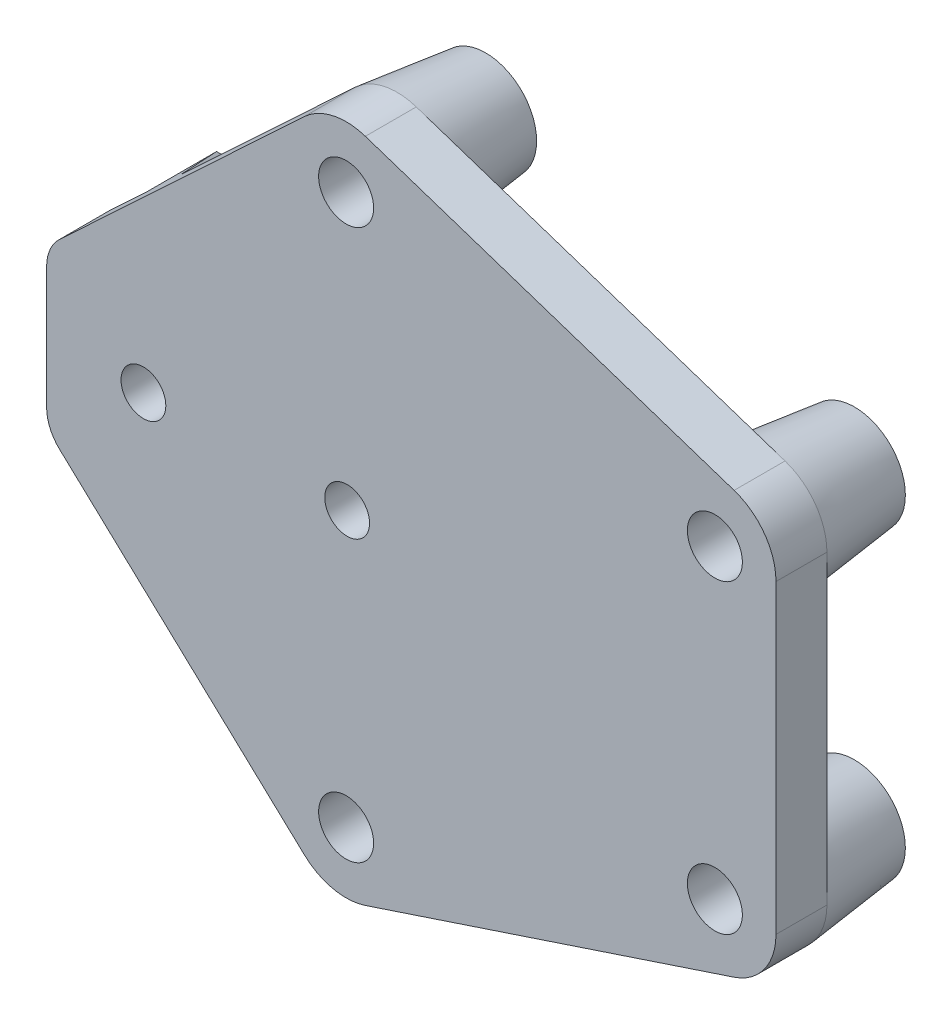
from build123d import *

# Parameters (mm, degrees)
SKETCH_1_R       = 2.7
SKETCH_1_R_2     = 2.2
EXTRUDE_1_DEPTH  = 5
SKETCH_1_4_W     = 29.617054823
SKETCH_1_4_H     = 2
EXTRUDE_2_DEPTH  = 6.8
CHAMFER_1_SIZE   = 3
CHAMFER_1_SIZE_2 = 6.8
CHAMFER_2_SIZE   = 3
CHAMFER_2_SIZE_2 = 6.8


with BuildPart() as part:
    # 草图1 → 凸台-拉伸1 (new body)
    with BuildSketch(Plane.XY):
        with BuildLine():
            Line((-22.196745644, 31.383682827), (-46.231163763, 8.922455218))
            ThreePointArc((-46.231163763, 8.922455218), (-47.169104458, 7.593007368), (-47.5, 6))
            Line((-47.5, 6), (-47.5, -6))
            ThreePointArc((-47.5, -6), (-47.169104458, -7.593007368), (-46.231163763, -8.922455218))
            Line((-46.231163763, -8.922455218), (-22.196745644, -31.383682827))
            ThreePointArc((-22.196745644, -31.383682827), (-19.384432728, -32.860907145), (-16.212075635, -32.695238502))
            Line((-16.212075635, -32.695238502), (19.987924365, -20.695238502))
            ThreePointArc((19.987924365, -20.695238502), (22.964542434, -18.512296529), (24.1, -15))
            Line((24.1, -15), (24.1, 15))
            ThreePointArc((24.1, 15), (22.964542434, 18.512296529), (19.987924365, 20.695238502))
            Line((19.987924365, 20.695238502), (-16.212075635, 32.695238502))
            ThreePointArc((-16.212075635, 32.695238502), (-19.384432728, 32.860907145), (-22.196745644, 31.383682827))
        make_face()
        with Locations((18.1, -15)):
            Circle(SKETCH_1_R, mode=Mode.SUBTRACT)
        with Locations((-38, 0)):
            Circle(SKETCH_1_R_2, mode=Mode.SUBTRACT)
        with Locations((-18, 0)):
            Circle(SKETCH_1_R_2, mode=Mode.SUBTRACT)
        with Locations((-18.1, 27)):
            Circle(SKETCH_1_R, mode=Mode.SUBTRACT)
        with Locations((18.1, 15)):
            Circle(SKETCH_1_R, mode=Mode.SUBTRACT)
        with Locations((-18.1, -27)):
            Circle(SKETCH_1_R, mode=Mode.SUBTRACT)
    extrude(amount=EXTRUDE_1_DEPTH)

    # 草图4 → 旋转1 (revolve)
    with BuildSketch(Plane(origin=(6.272104728, 18.920849262, 0), x_dir=(-0.9492064169502825, 0.3146540608674969, 0), z_dir=(-0.3146540608674969, -0.9492064169502825, 0)), mode=Mode.PRIVATE) as revolve_1_sk:
        Polygon((-6.460825234, 0), (-7.460825234, 8.7), (-9.760825234, 8.7), (-9.760825234, 0), align=None)
    revolve_1 = revolve(revolve_1_sk.sketch.rotate(Axis((18.1, 15, 4.45283877), (0, 0, -1)), 161.660068966), axis=Axis((18.1, 15, 4.45283877), (0, 0, -1)))

    # 草图4<3> → 旋转2 (revolve)
    with BuildSketch(Plane(origin=(6.272104728, 18.920849262, 0), x_dir=(-0.9492064169502825, 0.3146540608674969, 0), z_dir=(-0.3146540608674969, -0.9492064169502825, 0)), mode=Mode.PRIVATE) as revolve_2_sk:
        Polygon((30.67629579, 8.7), (28.37629579, 8.7), (28.37629579, 0), (31.67629579, 0), align=None)
    revolve_2 = revolve(revolve_2_sk.sketch.rotate(Axis((-18.1, 27, 0), (0, 0, -1)), 161.660068966), axis=Axis((-18.1, 27, 0), (0, 0, -1)))

    # 镜向1: 旋转1, 旋转2 across plane
    add(revolve_1.mirror(Plane.ZX))
    add(revolve_2.mirror(Plane.ZX))

    # 草图1<4> → 凸台-拉伸2 (add)
    with BuildSketch(Plane.XY):
        with Locations((-27.808527412, 11.3)):
            Rectangle(SKETCH_1_4_W, SKETCH_1_4_H)
        with Locations((-27.808527412, -11.3)):
            Rectangle(SKETCH_1_4_W, SKETCH_1_4_H)
    extrude(amount=-EXTRUDE_2_DEPTH)

    # 倒角1
    # the kernel refuses this chamfer: 6.8, 3 mm, written as the material it adds along each edge
    with BuildSketch(Plane(origin=(-13, 12.3, 0), x_dir=(0, 0.9968133817371192, 0.07976892872421078), z_dir=(-1, 0, 0))) as chamfer_1_piece_1_section:
        Polygon((CHAMFER_1_SIZE * 0.996813381737, CHAMFER_1_SIZE * 0.0797689287242), (-CHAMFER_1_SIZE_2 * 0.0797689287242, CHAMFER_1_SIZE_2 * 0.996813381737), (0, 0), align=None)
    chamfer_1_piece_1 = extrude(amount=29.617054823, mode=Mode.PRIVATE)
    chamfer_1_piece_1 = split(chamfer_1_piece_1, bisect_by=Plane(origin=(-33.986119971, 20.365990665, -2.314362064), z_dir=(0.6827909407070696, -0.730613804474262, 0)), keep=Keep.TOP, mode=Mode.PRIVATE)
    chamfer_1_piece_1 = split(chamfer_1_piece_1, bisect_by=Plane(origin=(-27.310795563, 13.223124714, -6.8), z_dir=(0, 0, 1)), keep=Keep.TOP, mode=Mode.PRIVATE)
    add(chamfer_1_piece_1)

    # 倒角2
    # the kernel refuses this chamfer: 6.8, 3 mm, written as the material it adds along each edge
    with BuildSketch(Plane(origin=(-42.617054823, -12.3, 0), x_dir=(0, -0.9968133817371192, 0.07976892872421078), z_dir=(1, 0, 0))) as chamfer_2_piece_1_section:
        Polygon((CHAMFER_2_SIZE * 0.996813381737, CHAMFER_2_SIZE * 0.0797689287242), (-CHAMFER_2_SIZE_2 * 0.0797689287242, CHAMFER_2_SIZE_2 * 0.996813381737), (0, 0), align=None)
    chamfer_2_piece_1 = extrude(amount=29.617054823, mode=Mode.PRIVATE)
    chamfer_2_piece_1 = split(chamfer_2_piece_1, bisect_by=Plane(origin=(-33.986119971, -20.365990665, -2.314362064), z_dir=(0.6827909407070697, 0.7306138044742619, 0)), keep=Keep.TOP, mode=Mode.PRIVATE)
    chamfer_2_piece_1 = split(chamfer_2_piece_1, bisect_by=Plane(origin=(-27.310795563, -13.223124714, -6.8), z_dir=(0, 0, 1)), keep=Keep.TOP, mode=Mode.PRIVATE)
    add(chamfer_2_piece_1)


solid = part.part
